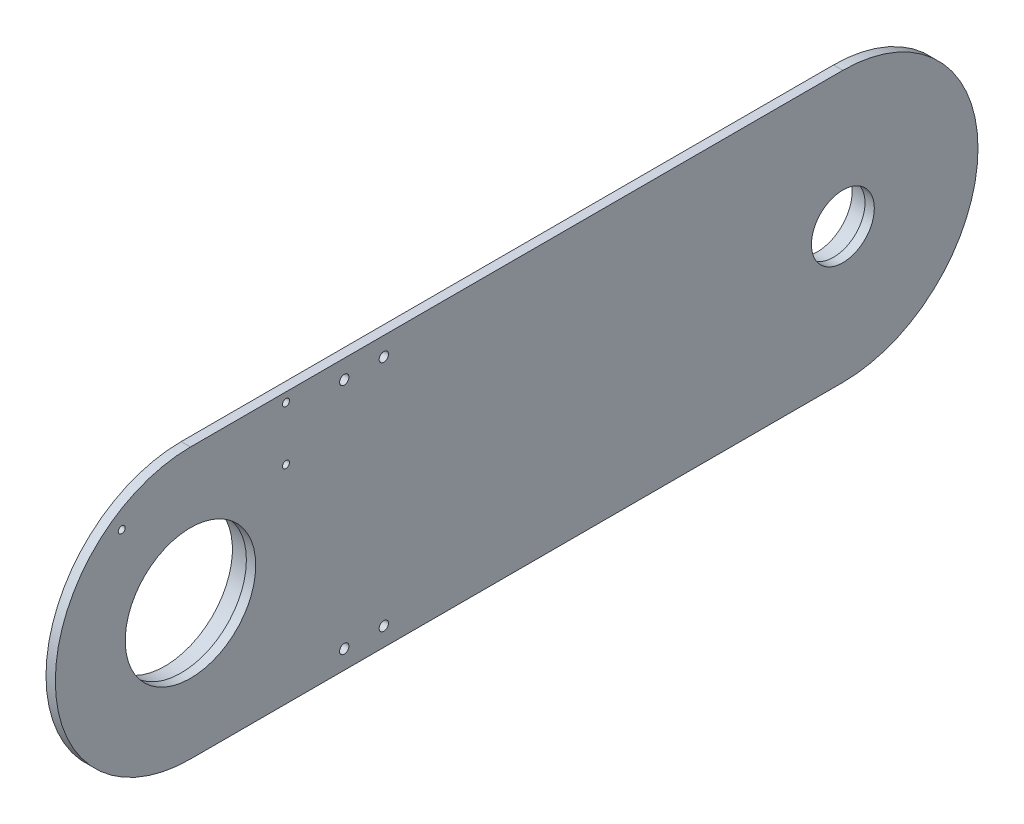
from build123d import *

# Parameters (mm, degrees)
SKETCH1_R           = 28
SKETCH1_R_2         = 13.5
BOSS_EXTRUDE1_DEPTH = 4
SKETCH2_R           = 34
SKETCH2_R_2         = 29
SKETCH2_R_3         = 20
SKETCH2_R_4         = 15
BOSS_EXTRUDE2_DEPTH = 7
CHAMFER1_SIZE       = 8
SKETCH3_R           = 2
CUT_EXTRUDE1_DEPTH  = 344.011661609
SKETCH4_R           = 1.5
CUT_EXTRUDE2_DEPTH  = 344.116598258
SKETCH5_R           = 1.5
CUT_EXTRUDE3_DEPTH  = 5


with BuildPart() as part:
    # Sketch1 → Boss-Extrude1 (new body)
    with BuildSketch(Plane(origin=(0, 0, 0), x_dir=(0, 0, -1), z_dir=(1, 0, 0))):
        with BuildLine():
            Line((0, 58), (280, 58))
            ThreePointArc((280, 58), (338, 0), (280, -58))
            Line((280, -58), (0, -58))
            ThreePointArc((0, -58), (-58, 0), (0, 58))
        make_face()
        Circle(SKETCH1_R, mode=Mode.SUBTRACT)
        with Locations((280, 0)):
            Circle(SKETCH1_R_2, mode=Mode.SUBTRACT)
    extrude(amount=BOSS_EXTRUDE1_DEPTH)

    # Sketch2 → Boss-Extrude2 (add)
    # profile 1 of 2: a face of its own
    with BuildSketch(Plane.ZY.offset(7)):
        Circle(SKETCH2_R)
        Circle(SKETCH2_R_2, mode=Mode.SUBTRACT)
    # profile 2 of 2: a face of its own
    with BuildSketch(Plane.ZY.offset(7)):
        with Locations((-280, 0)):
            Circle(SKETCH2_R_3)
        with Locations((-280, 0)):
            Circle(SKETCH2_R_4, mode=Mode.SUBTRACT)
    extrude(amount=-BOSS_EXTRUDE2_DEPTH)

    # Chamfer1
    # the kernel refuses this chamfer: 8 mm, written as the material it adds along each edge
    with BuildSketch(Plane(origin=(0, 0, 0), x_dir=(0, 0, 1), z_dir=(0, -1, 0))) as chamfer1_piece_1_section:
        Polygon((34 + CHAMFER1_SIZE, 0), (34, CHAMFER1_SIZE), (34, 0), align=None)
    chamfer1_piece_1 = revolve(axis=Axis((0, 0, 0), (-1, 0, 0)), mode=Mode.PRIVATE)
    chamfer1_piece_1 = split(chamfer1_piece_1, bisect_by=Plane(origin=(-7, 0, -38.472213865), z_dir=(1, 0, 0)), keep=Keep.TOP, mode=Mode.PRIVATE)
    add(chamfer1_piece_1)
    with BuildSketch(Plane(origin=(0, 0, -280), x_dir=(0, 0, 1), z_dir=(0, -1, 0))) as chamfer1_piece_2_section:
        Polygon((20 + CHAMFER1_SIZE, 0), (20, CHAMFER1_SIZE), (20, 0), align=None)
    chamfer1_piece_2 = revolve(axis=Axis((0, 0, -280), (-1, 0, 0)), mode=Mode.PRIVATE)
    chamfer1_piece_2 = split(chamfer1_piece_2, bisect_by=Plane(origin=(-7, 0, -304.493064149), z_dir=(1, 0, 0)), keep=Keep.TOP, mode=Mode.PRIVATE)
    add(chamfer1_piece_2)

    # Sketch3 → Cut-Extrude1 (cut, through all)
    with BuildSketch(Plane.ZY):
        with Locations((-66, 50)):
            Circle(SKETCH3_R)
        with Locations(Location((-66, -50, 0), (0, 0, 180))):
            Circle(SKETCH3_R)
        with Locations((-83, -50)):
            Circle(SKETCH3_R)
        with Locations(Location((-83, 50, 0), (0, 0, 180))):
            Circle(SKETCH3_R)
    extrude(amount=-CUT_EXTRUDE1_DEPTH, mode=Mode.SUBTRACT)

    # Sketch4 → Cut-Extrude2 (cut, through all)
    with BuildSketch(Plane(origin=(4, 0, 0), x_dir=(0, 0, -1), z_dir=(1, 0, 0))):
        with Locations((-29.5, 42)):
            Circle(SKETCH4_R)
        with Locations((41, 54)):
            Circle(SKETCH4_R)
        with Locations((41, 31)):
            Circle(SKETCH4_R)
    extrude(amount=-CUT_EXTRUDE2_DEPTH, mode=Mode.SUBTRACT)

    # Sketch5 → Cut-Extrude3 (cut)
    with BuildSketch(Plane.ZY.offset(7)):
        with Locations((-280, 17)):
            Circle(SKETCH5_R)
        with Locations((-263, 0)):
            Circle(SKETCH5_R)
        with Locations((-280, -17)):
            Circle(SKETCH5_R)
        with Locations((-297, 0)):
            Circle(SKETCH5_R)
    extrude(amount=-CUT_EXTRUDE3_DEPTH, mode=Mode.SUBTRACT)


solid = part.part
